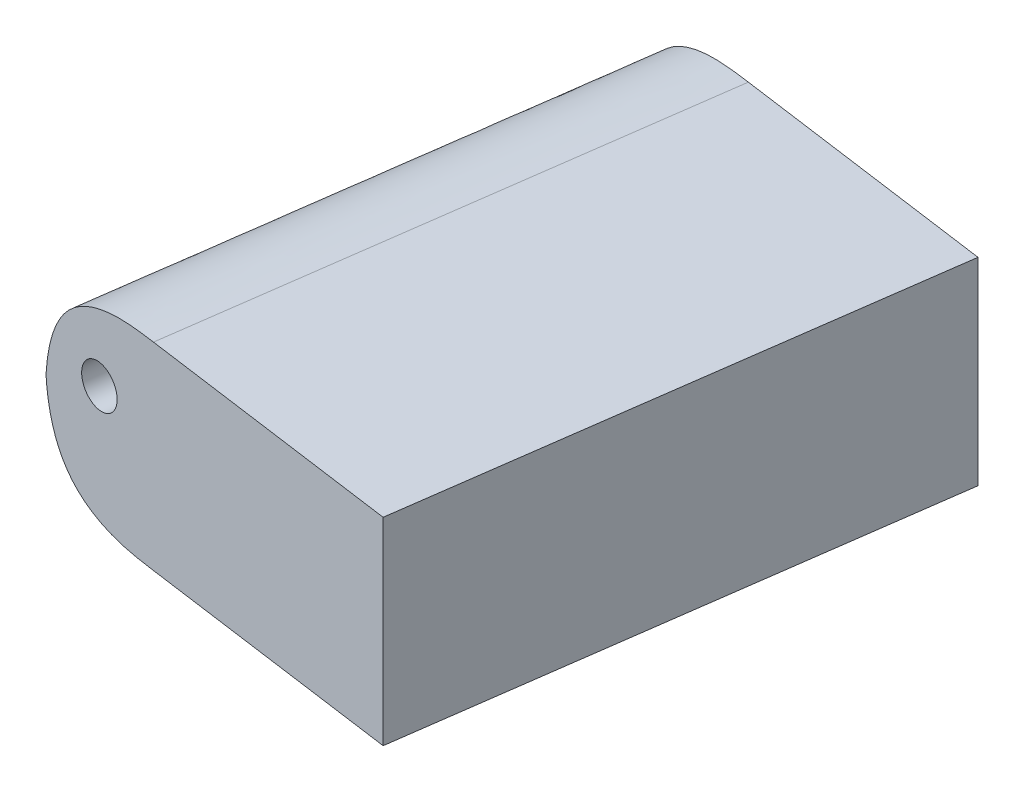
from build123d import *

# Parameters (mm, degrees)
BOSS_EXTRUDE1_DEPTH = 9.525
SKETCH3_R           = 2.032
CUT_EXTRUDE1_DEPTH  = 2.7
SKETCH4_R           = 1.000000032
CUT_EXTRUDE2_DEPTH  = 51.984772229
FILLET2_SIZE        = 6.096


with BuildPart() as part:
    # Sketch1 → Boss-Extrude1 (new body)
    with BuildSketch(Plane(origin=(0, 0, 0), x_dir=(1, 0, 0), z_dir=(0, 1, 0))):
        Polygon((-27.422743224, -19.119856123), (-46.29298428, -16.509012872), (-42.811859946, 8.651308536), (-23.941618889, 6.040465285), align=None)
    extrude(amount=BOSS_EXTRUDE1_DEPTH)

    # Sketch3 → Cut-Extrude1 (cut)
    with BuildSketch(Plane(origin=(0.316670388, 0, -2.684144047), x_dir=(-0.9905638349724136, 0, -0.13705213914691383), z_dir=(0.13705213914691383, 0, -0.9905638349724136))):
        with Locations((40.495544979, 5.969)):
            Circle(SKETCH3_R)
    extrude(amount=-CUT_EXTRUDE1_DEPTH, mode=Mode.SUBTRACT)

    # Sketch4 → Cut-Extrude2 (cut, through all)
    with BuildSketch(Plane(origin=(0.000303759, 0, -0.00219546), x_dir=(-0.9905638349724136, 0, -0.13705213914691383), z_dir=(0.1370521391469138, 0, -0.9905638349724135))):
        with Locations((40.549730429, 5.969)):
            Circle(SKETCH4_R)
    extrude(amount=-CUT_EXTRUDE2_DEPTH, mode=Mode.SUBTRACT)

    # Fillet2
    # a fillet whose section is not a circle: 6.096 mm, written as the material it takes off along each edge
    with BuildSketch(Plane(origin=(-48.38165888, 0, 31.605205717), x_dir=(0.9905638349724136, 0, 0.13705213914691353), z_dir=(0.13705213914691353, 0, -0.9905638349724136))) as fillet2_piece_1:
        with BuildLine():
            add(Edge.make_bspline([(FILLET2_SIZE, 0), (FILLET2_SIZE * 0.831801948466, 0), (FILLET2_SIZE * 0.663603896932, 0), (FILLET2_SIZE * 0.292893218813, -FILLET2_SIZE * 0.0716919198361), (FILLET2_SIZE * 0.0716919198361, -FILLET2_SIZE * 0.292893218813), (0, -FILLET2_SIZE * 0.663603896932), (0, -FILLET2_SIZE * 0.831801948466), (0, -FILLET2_SIZE)], knots=[0, 0, 0, 0, 0, 0, 0.5, 0.5, 1, 1, 1, 1, 1, 1], degree=5))
            Line((0, -FILLET2_SIZE), (0, 0))
            Line((0, 0), (FILLET2_SIZE, 0))
        make_face()
    extrude(amount=55.88, mode=Mode.SUBTRACT)
    with BuildSketch(Plane(origin=(-48.38165888, 9.525, 31.605205717), x_dir=(0.9905638349724136, 0, 0.13705213914691353), z_dir=(0.13705213914691353, 0, -0.9905638349724136))) as fillet2_piece_2:
        with BuildLine():
            add(Edge.make_bspline([(FILLET2_SIZE, 0), (FILLET2_SIZE * 0.831801948466, 0), (FILLET2_SIZE * 0.663603896932, 0), (FILLET2_SIZE * 0.292893218813, FILLET2_SIZE * 0.0716919198361), (FILLET2_SIZE * 0.0716919198361, FILLET2_SIZE * 0.292893218813), (0, FILLET2_SIZE * 0.663603896932), (0, FILLET2_SIZE * 0.831801948466), (0, FILLET2_SIZE)], knots=[0, 0, 0, 0, 0, 0, 0.5, 0.5, 1, 1, 1, 1, 1, 1], degree=5))
            Line((0, FILLET2_SIZE), (0, 0))
            Line((0, 0), (FILLET2_SIZE, 0))
        make_face()
    extrude(amount=55.88, mode=Mode.SUBTRACT)


solid = part.part
